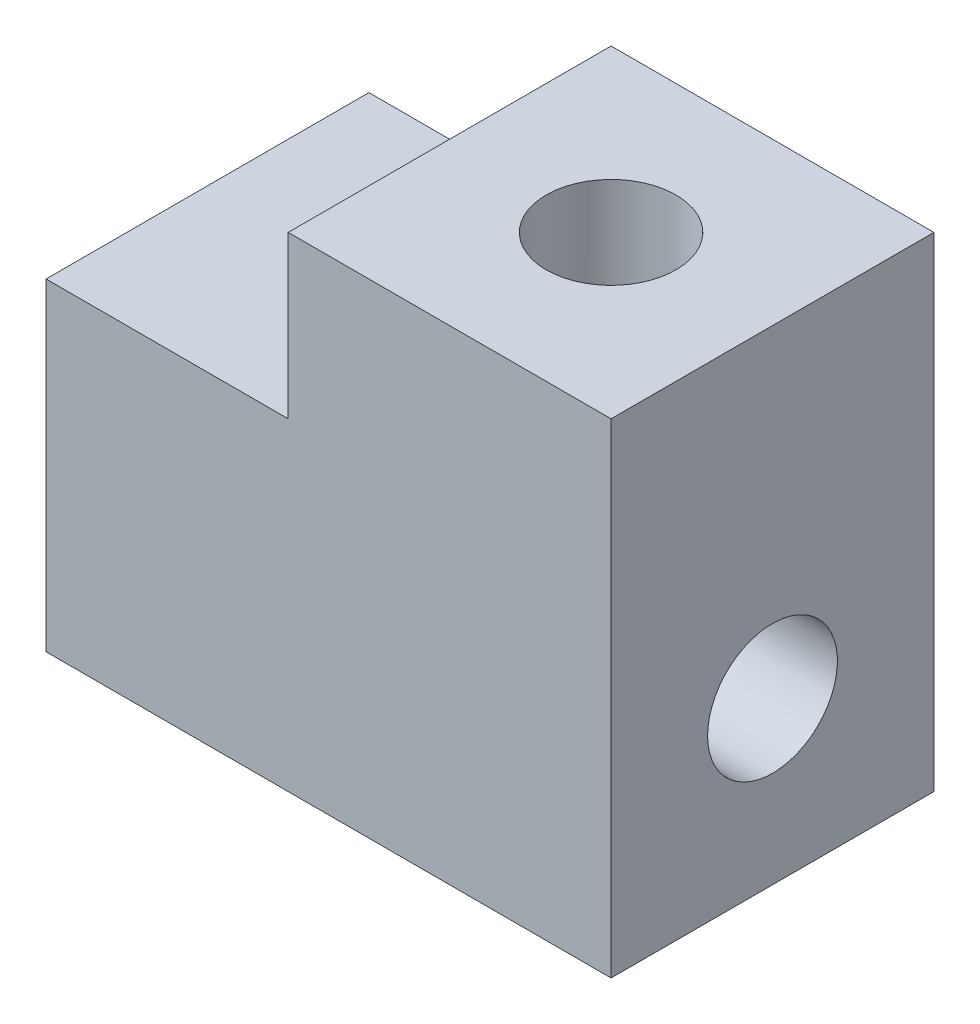
from build123d import *

# Parameters (mm, degrees)
BOSS_EXTRUDE1_DEPTH     = 12.7
F_1_4_20_TAPPED_HOLE1_D = 5.1054
F_1_4_20_TAPPED_HOLE2_D = 5.1054


with BuildPart() as part:
    # Sketch1 → Boss-Extrude1 (new body)
    with BuildSketch(Plane.XY):
        Polygon((0, 0), (0, 19.05), (-12.7, 19.05), (-12.7, 12.7), (-22.225, 12.7), (-22.225, 0), align=None)
    extrude(amount=BOSS_EXTRUDE1_DEPTH)

    # 1/4-20 Tapped Hole1 (through all)
    with Locations(Plane(origin=(0, 19.05, 0), x_dir=(1, 0, 0), z_dir=(0, 1, 0))):
        with Locations((-6.35, -6.35)):
            Hole(F_1_4_20_TAPPED_HOLE1_D / 2)

    # 1/4-20 Tapped Hole2 (through all)
    with Locations(Plane.ZY.offset(22.225)):
        with Locations((6.35, 6.35)):
            Hole(F_1_4_20_TAPPED_HOLE2_D / 2)


solid = part.part
